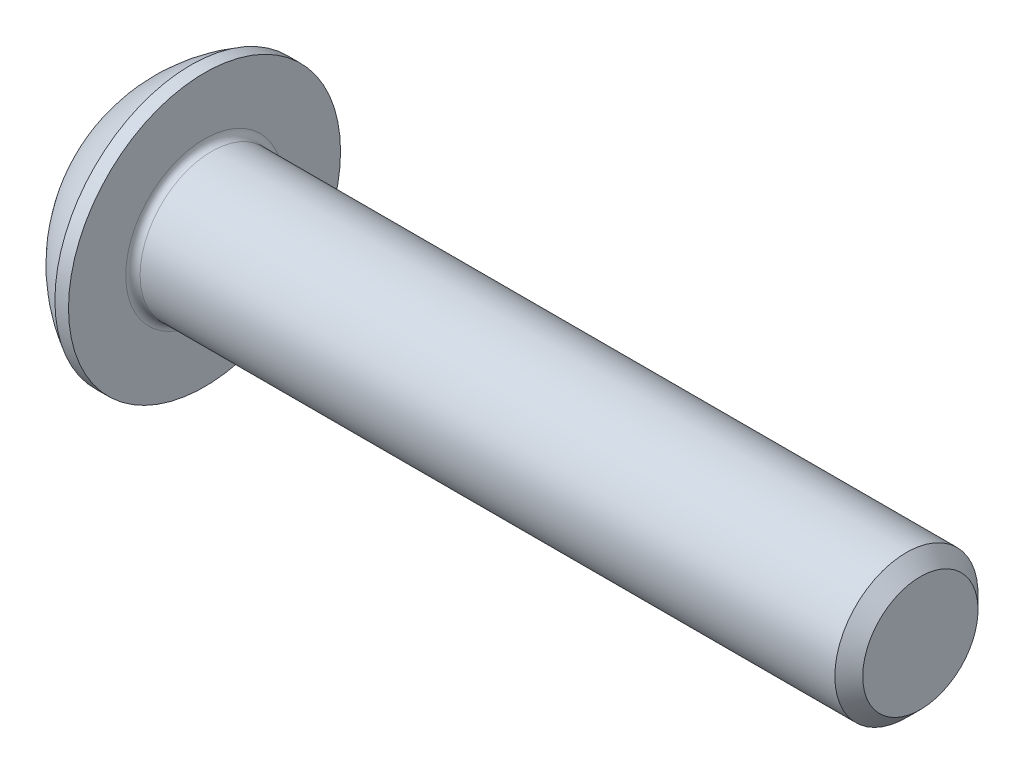
from build123d import *

# Parameters (mm, degrees)
FILLET1_R   = 0.2
HEX_2_DEPTH = 1.3


with BuildPart() as part:
    # BodySke → BaseBody (revolve)
    with BuildSketch(Plane.XY):
        with BuildLine():
            Line((22.2, 0), (22.2, 1.61))
            Line((22.2, 1.61), (21.81, 2))
            Line((21.81, 2), (2.2, 2))
            Line((2.2, 2), (2.2, 3.8))
            Line((2.2, 3.8), (1.82, 3.8))
            ThreePointArc((1.82, 3.8), (0.762013659, 2.991755338), (0, 1.9))
            Line((0, 1.9), (0, 0))
            Line((0, 0), (22.2, 0))
        make_face()
    revolve(axis=Axis((0, 0, 0), (1, 0, 0)))

    # Fillet1
    fillet1_edges = [part.edges().sort_by_distance(p)[0] for p in [
        (2.2, -2, 0),
    ]]
    fillet(fillet1_edges, radius=FILLET1_R)

    # Sketch2 → PreBroach (revolve, cut)
    with BuildSketch(Plane.XY):
        Polygon((0, 1.25), (1.3, 1.25), (2.021687836, 0), (0, 0), align=None)
    revolve(axis=Axis((0, 0, 0), (1, 0, 0)), mode=Mode.SUBTRACT)

    # Sketch3 → Hex 2 (cut)
    with BuildSketch(Plane(origin=(0, 0, 0), x_dir=(0, 0, -1), z_dir=(1, 0, 0))):
        Polygon((-1.25, -0.721687836), (-1.25, 0.721687836), (0, 1.443375673), (1.25, 0.721687836), (1.25, -0.721687836), (0, -1.443375673), align=None)
    extrude(amount=HEX_2_DEPTH, mode=Mode.SUBTRACT)


solid = part.part
